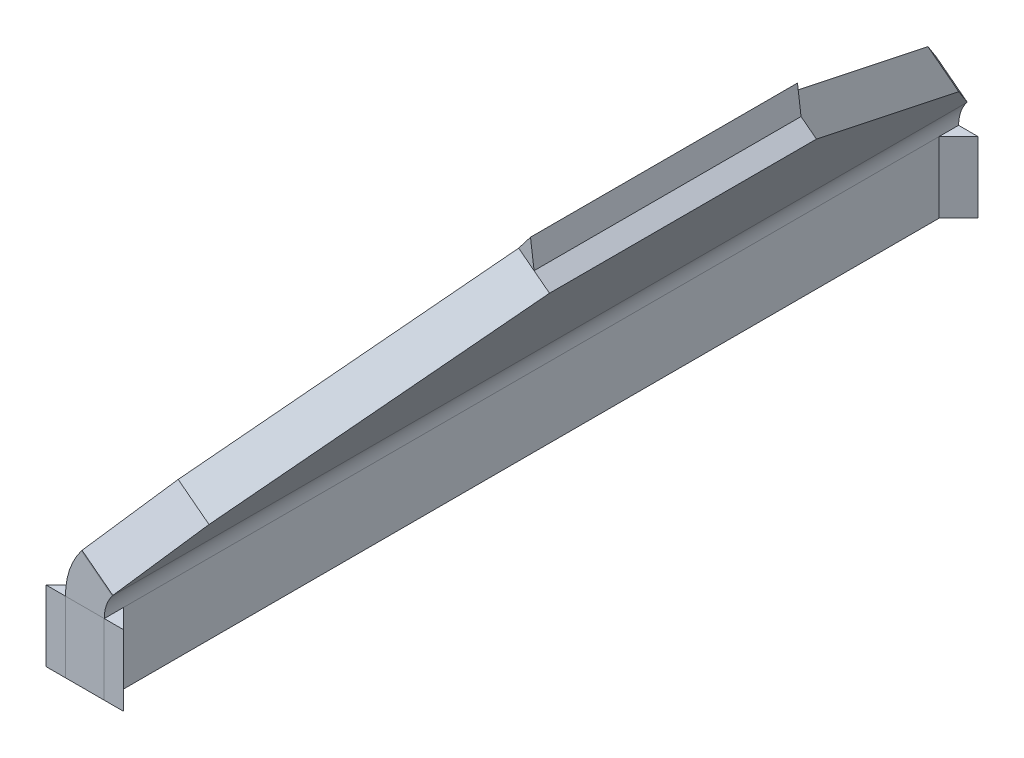
from build123d import *

# Parameters (mm, degrees)
SM_BASE_FLANGE_1_DEPTH = 44
CUT_EXTRUDE_1_DEPTH    = 58.421720735
EXTRUDE_START          = 13.75
EXTRUDE_2_DEPTH        = 27.5
EXTRUDE_3_DEPTH        = 7.284366
EXTRUDE_3_2_DEPTH      = 7.284366
EXTRUDE_3_3_DEPTH      = 7.284366
EXTRUDE_3_4_DEPTH      = 7.284366


# Sheet-metal steps are written as plain solids
with BuildPart() as part:
    # Sketch 1 → Базовая кромка1 (new, symmetric)
    with BuildSketch(Plane.XY):
        with BuildLine():
            Line((0, 0), (0, 7.284365929))
            ThreePointArc((0, 7.284365929), (0.424558964, 9.855881652), (1.653173278, 12.154457361))
            Line((1.653173278, 12.154457361), (16.436558583, 31.420540188))
            Line((16.436558583, 31.420540188), (19.609971944, 28.985494472))
            Line((19.609971944, 28.985494472), (4.826586639, 9.719411645))
            ThreePointArc((4.826586639, 9.719411645), (4.212279482, 8.57012379), (4, 7.284365929))
            Line((4, 7.284365929), (4, 0))
            Line((4, 0), (0, 0))
        make_face()
    extrude(amount=SM_BASE_FLANGE_1_DEPTH, both=True)

    # Эскиз3 → Вытянуть1 (cut, through all)
    with BuildSketch(Plane(origin=(-1.65621577, 1.270859058, 0), x_dir=(0, 0, -1), z_dir=(0.7933533402912344, -0.6087614290087218, 0))):
        Polygon((-44, 10.74743452), (-44, 34.933533403), (-13.75, 34.933533403), (-38.611255778, 18.164404641), align=None)
        Polygon((44, 34.933533403), (13.75, 34.933533403), (38.611255778, 18.164404641), (44, 10.74743452), align=None)
    extrude(amount=-CUT_EXTRUDE_1_DEPTH, mode=Mode.SUBTRACT)


with BuildPart() as body_2:
    # Эскиз4 → Вытянуть2 (new body)
    with BuildSketch(Plane.XY.offset(EXTRUDE_START)):
        Polygon((16.436558583, 31.420540188), (18.023265264, 30.20301733), (17.654081441, 33.007246868), align=None)
    extrude(amount=-EXTRUDE_2_DEPTH)


with BuildPart() as body_3:
    # Эскиз5 → Вытянуть3 (new body)
    with BuildSketch(Plane.XZ):
        Polygon((0, 44), (0, 42), (-2, 44), align=None)
    extrude(amount=-EXTRUDE_3_DEPTH)


with BuildPart() as body_4:
    # Эскиз5 → Extrude 3 2 (new body)
    with BuildSketch(Plane.XZ):
        Polygon((6, 44), (4, 44), (4, 42), align=None)
    extrude(amount=-EXTRUDE_3_2_DEPTH)


with BuildPart() as body_5:
    # Эскиз5 → Extrude 3 3 (new body)
    with BuildSketch(Plane.XZ):
        Polygon((4, -44), (4, -42), (6, -44), align=None)
    extrude(amount=-EXTRUDE_3_3_DEPTH)


with BuildPart() as body_6:
    # Эскиз5 → Extrude 3 4 (new body)
    with BuildSketch(Plane.XZ):
        Polygon((-2, -44), (0, -44), (0, -42), align=None)
    extrude(amount=-EXTRUDE_3_4_DEPTH)


solid = Compound([part.part, body_2.part, body_3.part, body_4.part, body_5.part, body_6.part])
